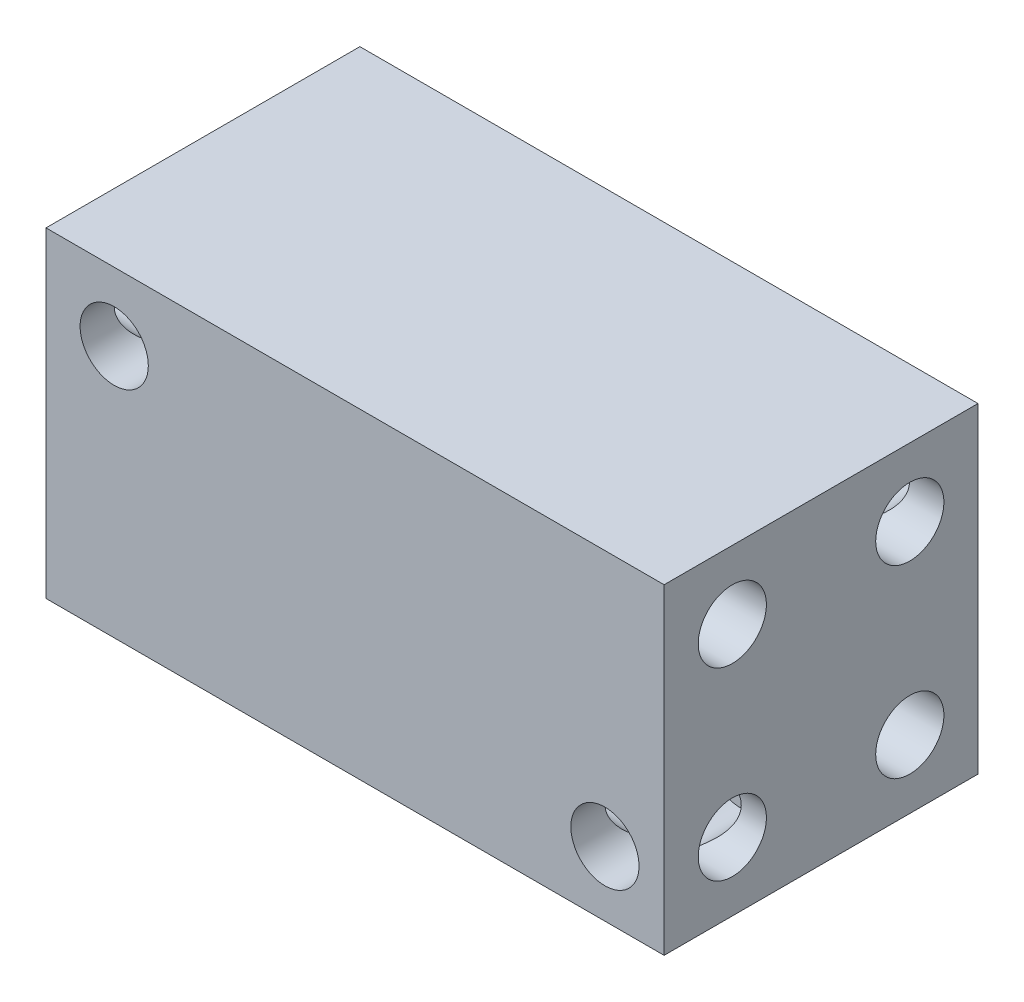
from build123d import *

# Parameters (mm, degrees)
SKETCH1_W               = 90.621510256
SKETCH1_H               = 47.057987938
BOSS_EXTRUDE1_DEPTH     = 23.009727366
BOSS_EXTRUDE3_START     = -90.621510256
BOSS_EXTRUDE3_OUTLINE_R = 5
BOSS_EXTRUDE3_DEPTH     = 90.621510256
SKETCH11_R              = 5
CUT_EXTRUDE3_DEPTH      = 19.832993722
CIRPATTERN1_COUNT       = 2
CIRPATTERN2_START       = -23.009727366
CIRPATTERN2_OUTLINE_R   = 5
CIRPATTERN2_DEPTH       = 19.832993722


# Read off the part's stored shape, not the designer's step: Boss-Extrude3, CirPattern2
with BuildPart() as part:
    # Sketch1 → Boss-Extrude1 (new body)
    with BuildSketch(Plane.XY):
        Rectangle(SKETCH1_W, SKETCH1_H)
    extrude(amount=BOSS_EXTRUDE1_DEPTH)

    # Boss-Extrude3 outline → Boss-Extrude3 (cut)
    with BuildSketch(Plane(origin=(45.310755128, 0, 0), x_dir=(0, 0, -1), z_dir=(1, 0, 0)).offset(BOSS_EXTRUDE3_START)):
        with Locations((-13.009727366, 13.528993969)):
            Circle(BOSS_EXTRUDE3_OUTLINE_R)
    boss_extrude3 = extrude(amount=BOSS_EXTRUDE3_DEPTH, mode=Mode.SUBTRACT)

    # Mirror4: Boss-Extrude3 across plane
    add(boss_extrude3.mirror(Plane.ZX), mode=Mode.SUBTRACT)

    # Mirror5: part across plane


with BuildPart() as part_1:
    add(part.part)
    add(part.part.mirror(Plane.XY))

    # Sketch11 → Cut-Extrude3 (cut)
    with BuildSketch(Plane.XY.offset(23.009727366)):
        with Locations((-35.310755128, 13.528993969)):
            Circle(SKETCH11_R)
    cut_extrude3 = extrude(amount=-CUT_EXTRUDE3_DEPTH, mode=Mode.SUBTRACT)

    # CirPattern1: Cut-Extrude3 ×2 about axis
    cirpattern1_axis = Axis((0.662529663, -0.253842201, 0), (0, 0, 1))
    for i in range(1, CIRPATTERN1_COUNT):
        add(cut_extrude3.rotate(cirpattern1_axis, i * 360 / CIRPATTERN1_COUNT), mode=Mode.SUBTRACT)

    # CirPattern2 outline → CirPattern2 (cut)
    with BuildSketch(Plane.XY.offset(CIRPATTERN2_START)):
        with Locations((-35.310755128, -13.528993969)):
            Circle(CIRPATTERN2_OUTLINE_R)
        with Locations((35.260080607, 13.509578489)):
            Circle(CIRPATTERN2_OUTLINE_R)
    extrude(amount=CIRPATTERN2_DEPTH, mode=Mode.SUBTRACT)


solid = part_1.part
